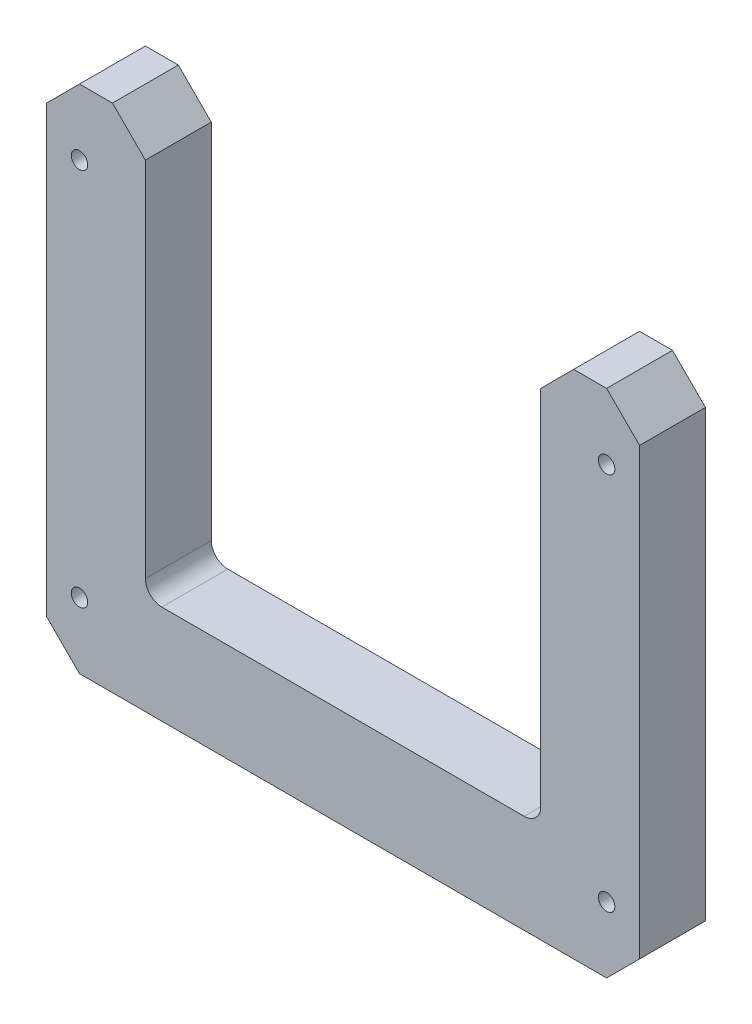
from build123d import *

# Parameters (mm, degrees)
BOSS_EXTRUDE1_DEPTH = 12.7
FILLET1_R           = 3.175
CHAMFER1_SIZE       = 6.35
HOLE1_D             = 3.175
HOLE1_DEPTH         = 31.75
HOLE1_CSINK_D       = 10.16
HOLE1_CSINK_ANGLE   = 82
HOLE1_TIP           = 0.953866233


with BuildPart() as part:
    # Sketch1 → Boss-Extrude1 (new body)
    with BuildSketch(Plane.XY):
        Polygon((-231.027465963, 69.04320968), (-231.027465963, -10.33179032), (-154.827465963, -10.33179032), (-154.827465963, 69.04320968), (-135.777465963, 69.04320968), (-135.777465963, -29.38179032), (-250.077465963, -29.38179032), (-250.077465963, 69.04320968), align=None)
    extrude(amount=BOSS_EXTRUDE1_DEPTH)

    # Fillet1
    fillet1_edges = [part.edges().sort_by_distance(p)[0] for p in [
        (-154.827465963, -10.33179032, 6.35),
        (-231.027465963, -10.33179032, 6.35),
    ]]
    fillet(fillet1_edges, radius=FILLET1_R)

    # Chamfer1
    chamfer1_edges = [part.edges().sort_by_distance(p)[0] for p in [
        (-250.077465963, -29.38179032, 6.35),
        (-135.777465963, -29.38179032, 6.35),
        (-135.777465963, 69.04320968, 6.35),
        (-154.827465963, 69.04320968, 6.35),
        (-250.077465963, 69.04320968, 6.35),
        (-231.027465963, 69.04320968, 6.35),
    ]]
    chamfer(chamfer1_edges, length=CHAMFER1_SIZE)

    # Hole1
    with Locations(Plane(origin=(-124.004465969, -126.387141225, -12.7), x_dir=(-1, 0, 0), z_dir=(0, 0, -1))):
        with Locations((113.649999994, 39.907623392), (113.649999994, -64.959043275), (-94.599999994, 72.474290059), (94.599999994, 72.474290059), (0, 72.474290059), (0, 104.224290059), (0, 351.653783621), (0, 213.070350905), (40.979166666, 213.070350905), (166.795833328, 213.070350905), (207.774999994, 351.653783621), (207.774999994, 244.12141023), (207.774999994, 136.58903684), (207.774999994, 48.524290059), (207.774999994, -78.475709941), (-207.774999994, -78.475709941), (-207.774999994, 48.524290059), (-207.774999994, 136.58903684), (-207.774999994, 244.12141023), (-207.774999994, 351.653783621), (-166.795833328, 213.070350905), (-40.979166666, 213.070350905), (-113.649999994, -64.959043275), (-113.649999994, 39.907623392), (119.722999994, 109.705350905), (119.722999994, 182.730350905), (18.122999994, 109.705350905), (18.122999994, 182.730350905)):
            CounterSinkHole(HOLE1_D / 2, HOLE1_CSINK_D / 2, depth=HOLE1_DEPTH, counter_sink_angle=HOLE1_CSINK_ANGLE)
            with Locations((0, 0, -(HOLE1_DEPTH + HOLE1_TIP / 2))):  # 118° drill point
                Cone(0, HOLE1_D / 2, HOLE1_TIP, mode=Mode.SUBTRACT)


solid = part.part
